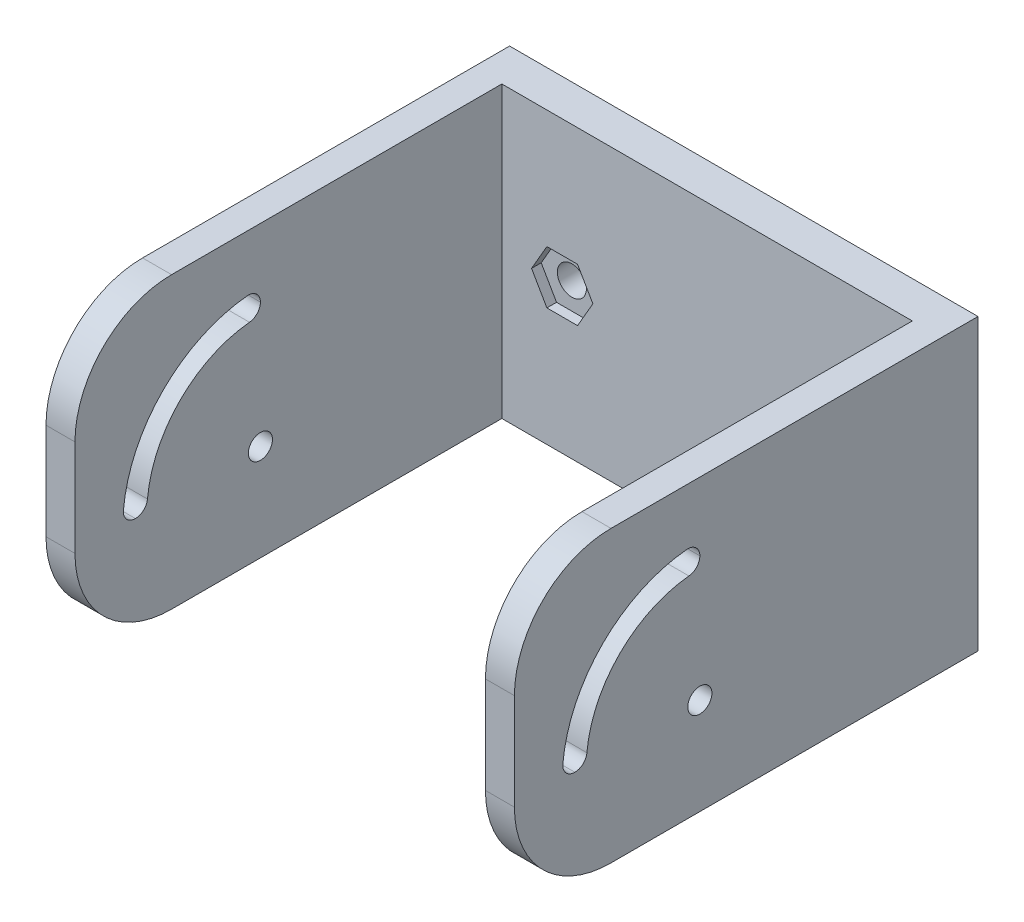
from build123d import *

# Parameters (mm, degrees)
BOSS_EXTRUDE1_DEPTH     = 30
CUT_EXTRUDE1_DEPTH      = 62.55558656
CUT_EXTRUDE1_DEPTH_BACK = 10
SKETCH4_R               = 1.5
CUT_EXTRUDE2_DEPTH      = 63.337896288
FILLET1_R               = 1.25
FILLET2_R               = 10
CUT_EXTRUDE3_DEPTH      = 1


with BuildPart() as part:
    # Sketch2 → Boss-Extrude1 (new body)
    with BuildSketch(Plane(origin=(0, 0, 0), x_dir=(1, 0, 0), z_dir=(0, 1, 0))):
        Polygon((26.115384615, 19.384615385), (-22.384615385, 19.384615385), (-22.384615385, -28.615384615), (-19.384615385, -28.615384615), (-19.384615385, 15.584615385), (23.115384615, 15.584615385), (23.115384615, -28.615384615), (26.115384615, -28.615384615), align=None)
    extrude(amount=BOSS_EXTRUDE1_DEPTH)

    # Sketch3 → Cut-Extrude1 (cut, two sides: drawn at the far end of the back side and taken through both)
    with BuildSketch(Plane(origin=(-19.384615385, 0, 0), x_dir=(0, 0, -1), z_dir=(1, 0, 0)).offset(-CUT_EXTRUDE1_DEPTH_BACK)):
        with BuildLine():
            ThreePointArc((-21.165384615, 10), (-17.723889294, 18.308504679), (-9.415384615, 21.75))
            Line((-9.415384615, 21.75), (-9.415384615, 24.25))
            ThreePointArc((-9.415384615, 24.25), (-19.491656247, 20.076271632), (-23.665384615, 10))
            Line((-23.665384615, 10), (-21.165384615, 10))
        make_face()
        with BuildLine():
            Line((-10.665384615, 10), (-9.415384615, 10))
            Line((-9.415384615, 10), (-9.415384615, 11.25))
            ThreePointArc((-9.415384615, 11.25), (-10.299268092, 10.883883476), (-10.665384615, 10))
        make_face()
        with BuildLine():
            Line((-9.415384615, 11.25), (-9.415384615, 10))
            Line((-9.415384615, 10), (-10.665384615, 10))
            ThreePointArc((-10.665384615, 10), (-9.415384615, 8.75), (-8.165384615, 10))
            ThreePointArc((-8.165384615, 10), (-8.531501139, 10.883883476), (-9.415384615, 11.25))
        make_face()
    extrude(amount=CUT_EXTRUDE1_DEPTH + CUT_EXTRUDE1_DEPTH_BACK, mode=Mode.SUBTRACT)

    # Sketch4 → Cut-Extrude2 (cut, through all)
    with BuildSketch(Plane(origin=(0, 0, -19.384615385), x_dir=(-1, 0, 0), z_dir=(0, 0, -1))):
        with Locations((-16.865384615, 15)):
            Circle(SKETCH4_R)
        with Locations((13.134615385, 15)):
            Circle(SKETCH4_R)
    extrude(amount=-CUT_EXTRUDE2_DEPTH, mode=Mode.SUBTRACT)

    # Fillet1
    fillet1_edges = [part.edges().sort_by_distance(p)[0] for p in [
        (-20.884615385, 24.25, 9.415384615),
        (-20.884615385, 21.75, 9.415384615),
        (-20.884615385, 10, 21.165384615),
        (-20.884615385, 10, 23.665384615),
        (24.615384615, 10, 23.665384615),
        (24.615384615, 10, 21.165384615),
        (24.615384615, 21.75, 9.415384615),
        (24.615384615, 24.25, 9.415384615),
    ]]
    fillet(fillet1_edges, radius=FILLET1_R - 0.0001)  # a hair under: the kernel refuses the full size

    # Fillet2
    fillet2_edges = [part.edges().sort_by_distance(p)[0] for p in [
        (-20.884615385, 30, 28.615384615),
        (24.615384615, 30, 28.615384615),
        (24.615384615, 0, 28.615384615),
        (-20.884615385, 0, 28.615384615),
    ]]
    fillet(fillet2_edges, radius=FILLET2_R)

    # Sketch5 → Cut-Extrude3 (cut)
    with BuildSketch(Plane.XY.offset(-15.584615385)):
        Polygon((-14.722328625, 12.25), (-11.546902144, 12.25), (-9.959188904, 15), (-11.546902144, 17.75), (-14.722328625, 17.75), (-16.310041865, 15), align=None)
        Polygon((15.277671375, 12.25), (18.453097856, 12.25), (20.040811096, 15), (18.453097856, 17.75), (15.277671375, 17.75), (13.689958135, 15), align=None)
    extrude(amount=-CUT_EXTRUDE3_DEPTH, mode=Mode.SUBTRACT)


solid = part.part
